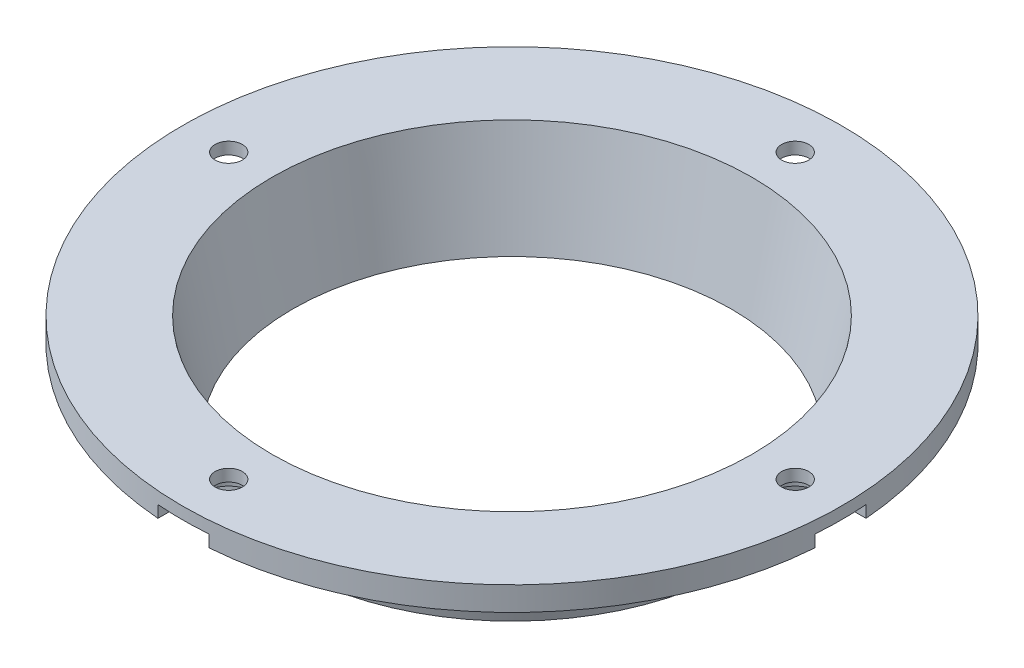
from build123d import *
from build123d.topology import SkipClean

# Parameters (mm, degrees)
SKETCH3_R           = 40
SKETCH3_R_2         = 35.480196097
BOSS_EXTRUDE1_DEPTH = 2
BOSS_EXTRUDE2_START = -2
SKETCH4_R           = 41.3
SKETCH4_R_2         = 40
BOSS_EXTRUDE2_DEPTH = 2
CUT_EXTRUDE1_DEPTH  = 10
SKETCH7_R           = 29.880196097
BOSS_EXTRUDE3_DEPTH = 0.5
BOSS_EXTRUDE4_START = 1
SKETCH8_R           = 41.3
SKETCH8_R_2         = 29.880196097
BOSS_EXTRUDE4_DEPTH = 1
SKETCH12_R          = 1.7
CUT_EXTRUDE2_DEPTH  = 60.256898333


# Read off the part's stored shape, not the designer's step: Revolve3
with BuildPart() as part:
    # Revolve3 outline → Revolve3 (revolve)
    with BuildSketch(Plane.XY):
        Polygon((35.480196097, 2), (29.880196097, 2), (27.480196097, -10), (28.5, -10), (30.5, 0), (35.480196097, 0), align=None)
    revolve(axis=Axis((0, 0, 0), (0, 1, 0)))

    # Sketch3 → Boss-Extrude1 (add)
    with BuildSketch(Plane(origin=(0, 2, 0), x_dir=(1, 0, 0), z_dir=(0, 1, 0))):
        with Locations(Location((0, 0, 0), (0, 0, 270))):
            Circle(SKETCH3_R)
        Circle(SKETCH3_R_2, mode=Mode.SUBTRACT)
    extrude(amount=-BOSS_EXTRUDE1_DEPTH)

    # Sketch4 → Boss-Extrude2 (add)
    with BuildSketch(Plane.XZ.offset(BOSS_EXTRUDE2_START)):
        with Locations(Location((0, 0, 0), (0, 0, 270))):
            Circle(SKETCH4_R)
        Circle(SKETCH4_R_2, mode=Mode.SUBTRACT)
    extrude(amount=BOSS_EXTRUDE2_DEPTH)

    # Sketch6 → Cut-Extrude1 (cut)
    with BuildSketch(Plane(origin=(0, 2, 0), x_dir=(1, 0, 0), z_dir=(0, 1, 0))):
        with BuildLine():
            ThreePointArc((41.3, 0), (41.268948935, 1.601203852), (41.175842432, 3.2))
            Line((41.175842432, 3.2), (35.5, 3.2))
            ThreePointArc((35.5, 3.2), (32.3, 0), (35.5, -3.2))
            Line((35.5, -3.2), (41.175842432, -3.2))
            ThreePointArc((41.175842432, -3.2), (41.268948935, -1.601203852), (41.3, 0))
        make_face()
        with BuildLine():
            ThreePointArc((-3.2, -41.175842432), (0, -41.3), (3.2, -41.175842432))
            Line((3.2, -41.175842432), (3.2, -35.5))
            ThreePointArc((3.2, -35.5), (0, -32.3), (-3.2, -35.5))
            Line((-3.2, -35.5), (-3.2, -41.175842432))
        make_face()
        with BuildLine():
            Line((-35.5, 3.2), (-41.175842432, 3.2))
            ThreePointArc((-41.175842432, 3.2), (-41.3, 0), (-41.175842432, -3.2))
            Line((-41.175842432, -3.2), (-35.5, -3.2))
            ThreePointArc((-35.5, -3.2), (-32.3, 0), (-35.5, 3.2))
        make_face()
        with BuildLine():
            ThreePointArc((-3.2, 35.5), (0, 32.3), (3.2, 35.5))
            Line((3.2, 35.5), (3.2, 41.175842432))
            ThreePointArc((3.2, 41.175842432), (0, 41.3), (-3.2, 41.175842432))
            Line((-3.2, 41.175842432), (-3.2, 35.5))
        make_face()
    extrude(amount=-CUT_EXTRUDE1_DEPTH, mode=Mode.SUBTRACT)

    # Sketch7 → Boss-Extrude3 (add)
    # profile 1 of 5: a face of its own
    with SkipClean():  # the faces are left unmerged after this step: merging them gives an invalid solid
        with BuildSketch(Plane(origin=(0, 2, 0), x_dir=(1, 0, 0), z_dir=(0, 1, 0))):
            with BuildLine():
                Line((41.175842432, -3.2), (35.5, -3.2))
                ThreePointArc((35.5, -3.2), (32.3, 0), (35.5, 3.2))
                Line((35.5, 3.2), (41.175842432, 3.2))
                ThreePointArc((41.175842432, 3.2), (29.203510063, 29.203510063), (3.2, 41.175842432))
                Line((3.2, 41.175842432), (3.2, 35.5))
                ThreePointArc((3.2, 35.5), (0, 32.3), (-3.2, 35.5))
                Line((-3.2, 35.5), (-3.2, 41.175842432))
                ThreePointArc((-3.2, 41.175842432), (-29.203510063, 29.203510063), (-41.175842432, 3.2))
                Line((-41.175842432, 3.2), (-35.5, 3.2))
                ThreePointArc((-35.5, 3.2), (-32.3, 0), (-35.5, -3.2))
                Line((-35.5, -3.2), (-41.175842432, -3.2))
                ThreePointArc((-41.175842432, -3.2), (-29.203510063, -29.203510063), (-3.2, -41.175842432))
                Line((-3.2, -41.175842432), (-3.2, -35.5))
                ThreePointArc((-3.2, -35.5), (0, -32.3), (3.2, -35.5))
                Line((3.2, -35.5), (3.2, -41.175842432))
                ThreePointArc((3.2, -41.175842432), (29.203510063, -29.203510063), (41.175842432, -3.2))
            make_face()
            Circle(SKETCH7_R, mode=Mode.SUBTRACT)
        # profile 2 of 5: a face of its own
        with BuildSketch(Plane(origin=(0, 2, 0), x_dir=(1, 0, 0), z_dir=(0, 1, 0))):
            with BuildLine():
                Line((-35.5, 3.2), (-41.175842432, 3.2))
                ThreePointArc((-41.175842432, 3.2), (-41.3, 0), (-41.175842432, -3.2))
                Line((-41.175842432, -3.2), (-35.5, -3.2))
                ThreePointArc((-35.5, -3.2), (-32.3, 0), (-35.5, 3.2))
            make_face()
        # profile 3 of 5: a face of its own
        with BuildSketch(Plane(origin=(0, 2, 0), x_dir=(1, 0, 0), z_dir=(0, 1, 0))):
            with BuildLine():
                ThreePointArc((-3.2, -41.175842432), (0, -41.3), (3.2, -41.175842432))
                Line((3.2, -41.175842432), (3.2, -35.5))
                ThreePointArc((3.2, -35.5), (0, -32.3), (-3.2, -35.5))
                Line((-3.2, -35.5), (-3.2, -41.175842432))
            make_face()
        # profile 4 of 5: a face of its own
        with BuildSketch(Plane(origin=(0, 2, 0), x_dir=(1, 0, 0), z_dir=(0, 1, 0))):
            with BuildLine():
                ThreePointArc((41.175842432, -3.2), (41.268948935, -1.601203852), (41.3, 0))
                ThreePointArc((41.3, 0), (41.268948935, 1.601203852), (41.175842432, 3.2))
                Line((41.175842432, 3.2), (35.5, 3.2))
                ThreePointArc((35.5, 3.2), (32.3, 0), (35.5, -3.2))
                Line((35.5, -3.2), (41.175842432, -3.2))
            make_face()
        # profile 5 of 5: a face of its own
        with BuildSketch(Plane(origin=(0, 2, 0), x_dir=(1, 0, 0), z_dir=(0, 1, 0))):
            with BuildLine():
                Line((3.2, 35.5), (3.2, 41.175842432))
                ThreePointArc((3.2, 41.175842432), (0, 41.3), (-3.2, 41.175842432))
                Line((-3.2, 41.175842432), (-3.2, 35.5))
                ThreePointArc((-3.2, 35.5), (0, 32.3), (3.2, 35.5))
            make_face()
        extrude(amount=-BOSS_EXTRUDE3_DEPTH)

    # Sketch8 → Boss-Extrude4 (add)
    with SkipClean():  # the faces are left unmerged after this step: merging them gives an invalid solid
        with BuildSketch(Plane(origin=(0, 2, 0), x_dir=(1, 0, 0), z_dir=(0, 1, 0)).offset(BOSS_EXTRUDE4_START)):
            with Locations(Location((0, 0, 0), (0, 0, 94.4438364))):
                Circle(SKETCH8_R)
            with Locations(Location((0, 0, 0), (0, 0, 270))):
                Circle(SKETCH8_R_2, mode=Mode.SUBTRACT)
        extrude(amount=-BOSS_EXTRUDE4_DEPTH)

    # Sketch12 → Cut-Extrude2 (cut, through all)
    with SkipClean():  # the faces are left unmerged after this step: merging them gives an invalid solid
        with BuildSketch(Plane.XZ):
            with Locations(Location((0, 35.5, 0), (0, 0, 270))):
                Circle(SKETCH12_R)
            with Locations(Location((35.5, 0, 0), (0, 0, 270))):
                Circle(SKETCH12_R)
            with Locations(Location((-35.5, 0, 0), (0, 0, 270))):
                Circle(SKETCH12_R)
            with Locations(Location((0, -35.5, 0), (0, 0, 270))):
                Circle(SKETCH12_R)
        extrude(amount=-CUT_EXTRUDE2_DEPTH, mode=Mode.SUBTRACT)

    # Sketch9 → Cut-Revolve2 (revolve, cut)
    with SkipClean():  # the faces are left unmerged after this step: merging them gives an invalid solid
        with BuildSketch(Plane.XY):
            Polygon((-27.480196097, -10), (-31.397991817, 9.588858549), (0, 9.588858549), (0, -10), align=None)
        revolve(axis=Axis((0, 9.588858549, 0), (0, -1, 0)), mode=Mode.SUBTRACT)


solid = part.part
